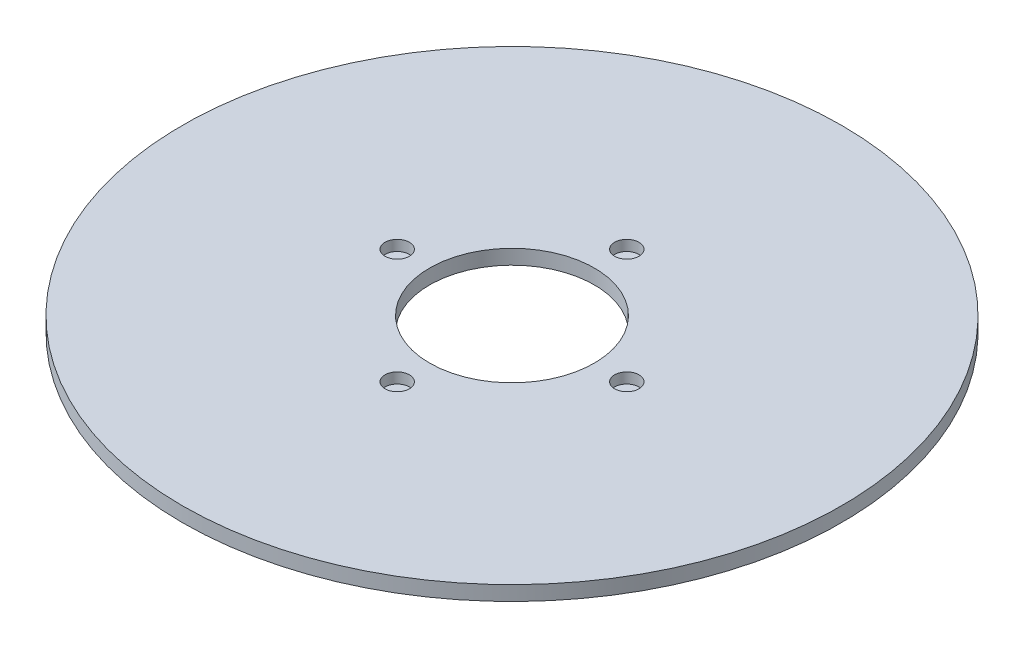
from build123d import *

# Parameters (mm, degrees)
SKETCH1_R           = 90
BOSS_EXTRUDE1_DEPTH = 4
SKETCH2_R           = 22.5
CUT_EXTRUDE1_DEPTH  = 128.342059038
SKETCH3_R           = 3.322390422
CUT_EXTRUDE2_DEPTH  = 2.878186203
CIRPATTERN1_COUNT   = 4


with BuildPart() as part:
    # Sketch1 → Boss-Extrude1 (new body)
    with BuildSketch(Plane(origin=(0, 0, 0), x_dir=(1, 0, 0), z_dir=(0, 1, 0))):
        Circle(SKETCH1_R)
    extrude(amount=BOSS_EXTRUDE1_DEPTH)

    # Sketch2 → Cut-Extrude1 (cut, through all)
    with BuildSketch(Plane(origin=(0, 0, 0), x_dir=(1, 0, 0), z_dir=(0, 1, 0))):
        Circle(SKETCH2_R)
    extrude(amount=CUT_EXTRUDE1_DEPTH, mode=Mode.SUBTRACT)

    # Sketch3 → Cut-Extrude2 (cut)
    with BuildSketch(Plane(origin=(0, 4, 0), x_dir=(1, 0, 0), z_dir=(0, 1, 0))):
        with Locations((-31.349348146, 0)):
            Circle(SKETCH3_R)
    cut_extrude2 = extrude(amount=-CUT_EXTRUDE2_DEPTH, mode=Mode.SUBTRACT)

    # CirPattern1: Cut-Extrude2 ×4 about axis
    cirpattern1_axis = Axis((0, 0, 0), (0, 1, 0))
    for i in range(1, CIRPATTERN1_COUNT):
        add(cut_extrude2.rotate(cirpattern1_axis, i * 360 / CIRPATTERN1_COUNT), mode=Mode.SUBTRACT)


solid = part.part
